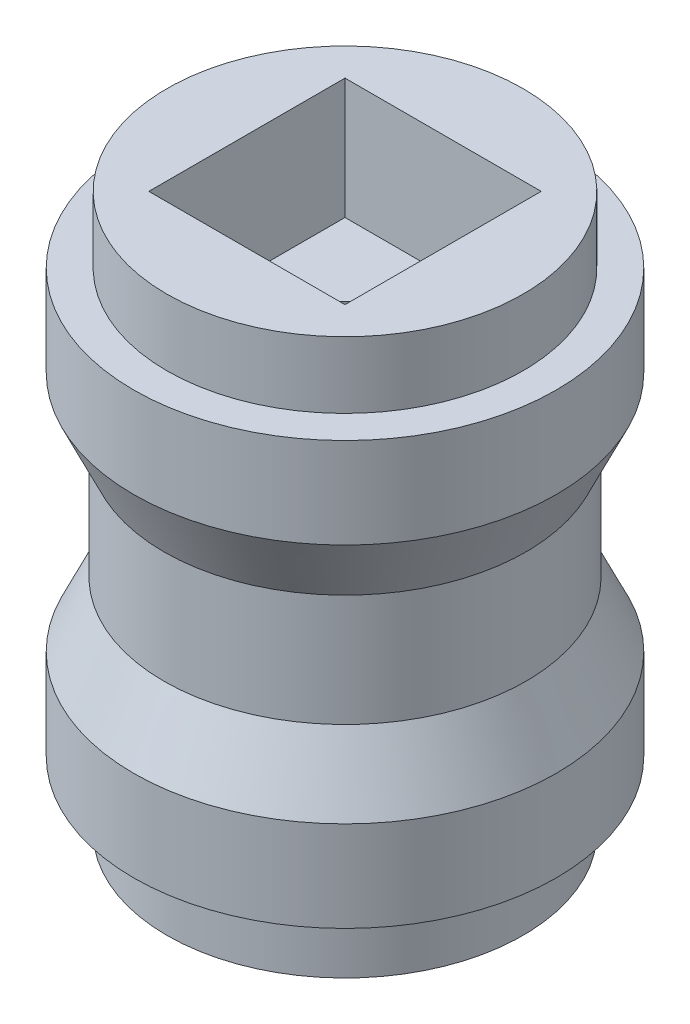
from build123d import *

# Parameters (mm, degrees)
SKETCH_1_R          = 7
EXTRUDE_1_DEPTH     = 3
SKETCH_2_R          = 6
EXTRUDE_2_DEPTH     = 8
SKETCH_3_R          = 7
EXTRUDE_3_DEPTH     = 3
CHAMFER_1_SIZE      = 2.144506921
CHAMFER_1_SIZE_2    = 1
CHAMFER_2_SIZE      = 2.144506921
CHAMFER_2_SIZE_2    = 1
SKETCH_4_R          = 5.9
EXTRUDE_4_DEPTH     = 2.2
EXTRUDE_START       = 2.2
SKETCH_5_R          = 5.9
EXTRUDE_5_DEPTH     = 2.2
SKETCH_6_W          = 6.5
SKETCH_6_H          = 6.5
CUT_EXTRUDE_1_DEPTH = 4
SKETCH_7_W          = 6.5
SKETCH_7_H          = 6.5
CUT_EXTRUDE_2_DEPTH = 4
SKETCH_8_R          = 1.2
CUT_EXTRUDE_3_DEPTH = 18.474552927


with BuildPart() as part:
    # Эскиз1 → Бобышка-Вытянуть1 (new body)
    with BuildSketch(Plane(origin=(0, 0, 0), x_dir=(1, 0, 0), z_dir=(0, 1, 0))):
        with Locations(Location((0, 0, 0), (0, 0, 270))):
            Circle(SKETCH_1_R)
    extrude(amount=EXTRUDE_1_DEPTH)

    # Эскиз2 → Бобышка-Вытянуть2 (add)
    with BuildSketch(Plane(origin=(0, 3, 0), x_dir=(1, 0, 0), z_dir=(0, 1, 0))):
        with Locations(Location((0, 0, 0), (0, 0, 270))):
            Circle(SKETCH_2_R)
    extrude(amount=EXTRUDE_2_DEPTH)

    # Эскиз3 → Бобышка-Вытянуть3 (add)
    with BuildSketch(Plane(origin=(0, 11, 0), x_dir=(1, 0, 0), z_dir=(0, 1, 0))):
        with Locations(Location((0, 0, 0), (0, 0, 270))):
            Circle(SKETCH_3_R)
    extrude(amount=EXTRUDE_3_DEPTH)

    # Фаска1
    # the kernel refuses this chamfer: 2.144506921, 1 mm, written as the material it adds along each edge
    with BuildSketch(Plane(origin=(0, 3, 0), x_dir=(0, 0, 1), z_dir=(-1, 0, 0))) as chamfer_1_piece_1_section:
        Polygon((6, CHAMFER_1_SIZE), (6 + CHAMFER_1_SIZE_2, 0), (6, 0), align=None)
    chamfer_1_piece_1 = revolve(axis=Axis((0, 3, 0), (0, 1, 0)), mode=Mode.PRIVATE)
    chamfer_1_piece_1 = chamfer_1_piece_1 & Plane(origin=(0, 4.095664656, 0), x_dir=(0, 0, 1), z_dir=(0, -1, 0)) * Cylinder(7, 28, mode=Mode.PRIVATE)
    add(chamfer_1_piece_1)

    # Фаска2
    # the kernel refuses this chamfer: 2.144506921, 1 mm, written as the material it adds along each edge
    with BuildSketch(Plane(origin=(0, 11, 0), x_dir=(0, 0, 1), z_dir=(-1, 0, 0))) as chamfer_2_piece_1_section:
        Polygon((6, -CHAMFER_2_SIZE), (6 + CHAMFER_2_SIZE_2, 0), (6, 0), align=None)
    chamfer_2_piece_1 = revolve(axis=Axis((0, 11, 0), (0, 1, 0)), mode=Mode.PRIVATE)
    chamfer_2_piece_1 = chamfer_2_piece_1 & Plane(origin=(0, 9.904335344, 0), x_dir=(0, 0, 1), z_dir=(0, -1, 0)) * Cylinder(7, 28, mode=Mode.PRIVATE)
    add(chamfer_2_piece_1)

    # Эскиз4 → Бобышка-Вытянуть4 (add)
    with BuildSketch(Plane(origin=(0, 14, 0), x_dir=(1, 0, 0), z_dir=(0, 1, 0))):
        with Locations(Location((0, 0, 0), (0, 0, 270))):
            Circle(SKETCH_4_R)
    extrude(amount=EXTRUDE_4_DEPTH)

    # Эскиз5 → Бобышка-Вытянуть5 (add)
    with BuildSketch(Plane.XZ.offset(EXTRUDE_START)):
        with Locations(Location((0, 0, 0), (0, 0, 90))):
            Circle(SKETCH_5_R)
    extrude(amount=-EXTRUDE_5_DEPTH)

    # Эскиз6 → Вырез-Вытянуть1 (cut)
    with BuildSketch(Plane(origin=(0, 16.2, 0), x_dir=(1, 0, 0), z_dir=(0, 1, 0))):
        Rectangle(SKETCH_6_W, SKETCH_6_H)
    extrude(amount=-CUT_EXTRUDE_1_DEPTH, mode=Mode.SUBTRACT)

    # Эскиз7 → Вырез-Вытянуть2 (cut)
    with BuildSketch(Plane.XZ.offset(2.2)):
        Rectangle(SKETCH_7_W, SKETCH_7_H)
    extrude(amount=-CUT_EXTRUDE_2_DEPTH, mode=Mode.SUBTRACT)

    # Эскиз8 → Вырез-Вытянуть3 (cut, through all)
    with BuildSketch(Plane.XZ.offset(-1.8)):
        with Locations(Location((0, 0, 0), (0, 0, 270))):
            Circle(SKETCH_8_R)
    extrude(amount=-CUT_EXTRUDE_3_DEPTH, mode=Mode.SUBTRACT)


solid = part.part
